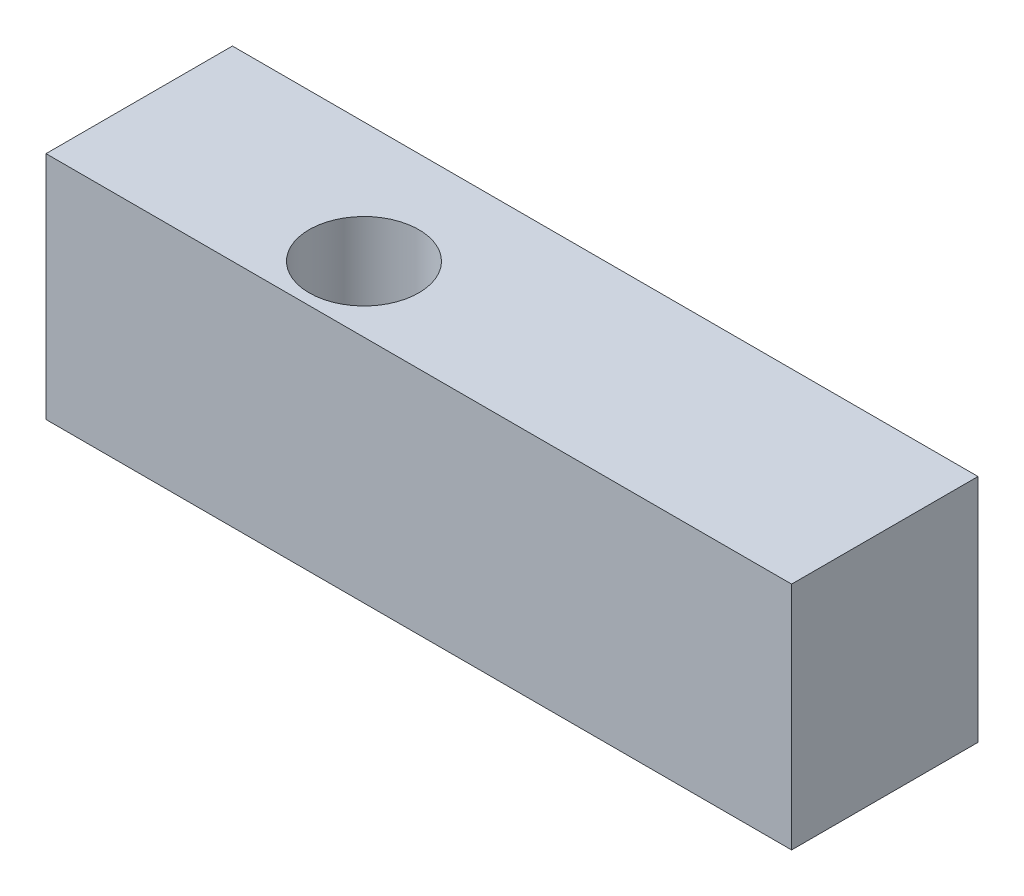
from build123d import *

# Parameters (mm, degrees)
SKETCH1_W           = 17.272
SKETCH1_H           = 5.334
BOSS_EXTRUDE1_DEPTH = 4.318
SKETCH2_R           = 1.27
CUT_EXTRUDE2_DEPTH  = 15.240051471


with BuildPart() as part:
    # Sketch1 → Boss-Extrude1 (new body)
    with BuildSketch(Plane.XY):
        with Locations((3.841274778, -0.284534644)):
            Rectangle(SKETCH1_W, SKETCH1_H)
    extrude(amount=BOSS_EXTRUDE1_DEPTH)

    # Sketch2 → Cut-Extrude2 (cut, through all)
    with BuildSketch(Plane(origin=(0, 2.382465356, 0), x_dir=(1, 0, 0), z_dir=(0, 1, 0))):
        with Locations((1.047274778, -2.794)):
            Circle(SKETCH2_R)
    extrude(amount=-CUT_EXTRUDE2_DEPTH, mode=Mode.SUBTRACT)


solid = part.part
